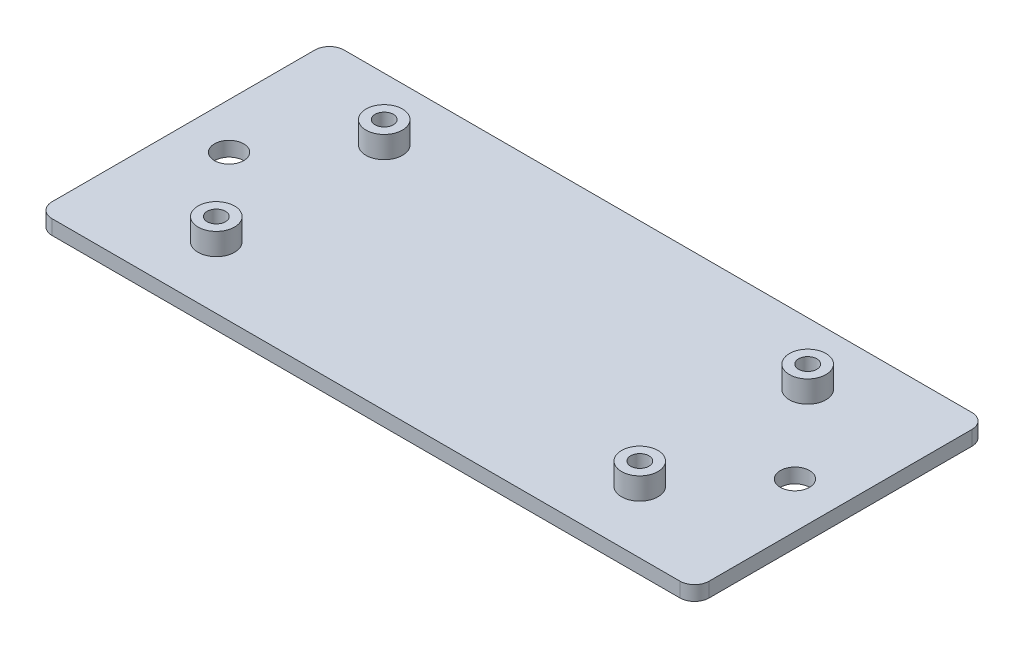
from build123d import *

# Parameters (mm, degrees)
SKETCH_1_W               = 90
SKETCH_1_H               = 40
EXTRUDE_1_DEPTH          = 2
SKETCH_2_R               = 2.5
EXTRUDE_2_DEPTH          = 3
CUT_EXTRUDE_1_DEPTH      = 99.615414617
CUT_EXTRUDE_1_DEPTH_BACK = 99.615414617
SKETCH_3_R               = 1.25
SKETCH_4_R               = 2
CUT_EXTRUDE_2_DEPTH      = 99.534258002
FILLET_1_R               = 2
FILLET_2_R               = 2
FILLET_3_R               = 2
FILLET_4_R               = 2


with BuildPart() as part:
    # Эскиз1 → Бобышка-Вытянуть1 (new body)
    with BuildSketch(Plane(origin=(0, 0, 0), x_dir=(1, 0, 0), z_dir=(0, 1, 0))):
        with Locations((45, -20)):
            Rectangle(SKETCH_1_W, SKETCH_1_H)
    extrude(amount=EXTRUDE_1_DEPTH)

    # Эскиз2 → Бобышка-Вытянуть2 (add)
    with BuildSketch(Plane(origin=(0, 2, 0), x_dir=(1, 0, 0), z_dir=(0, 1, 0))):
        with Locations((16, -8.5)):
            Circle(SKETCH_2_R)
        with Locations((16, -31.5)):
            Circle(SKETCH_2_R)
        with Locations((74, -8.5)):
            Circle(SKETCH_2_R)
        with Locations((74, -31.5)):
            Circle(SKETCH_2_R)
    extrude(amount=EXTRUDE_2_DEPTH)

    # Эскиз3 → Вырез-Вытянуть1 (cut, two sides: drawn at the far end of the back side and taken through both)
    with BuildSketch(Plane(origin=(0, 5, 0), x_dir=(1, 0, 0), z_dir=(0, 1, 0)).offset(-CUT_EXTRUDE_1_DEPTH_BACK)):
        with Locations((16, -8.5)):
            Circle(SKETCH_3_R)
        with Locations((16, -31.5)):
            Circle(SKETCH_3_R)
        with Locations((74, -8.5)):
            Circle(SKETCH_3_R)
        with Locations((74, -31.5)):
            Circle(SKETCH_3_R)
    extrude(amount=CUT_EXTRUDE_1_DEPTH + CUT_EXTRUDE_1_DEPTH_BACK, mode=Mode.SUBTRACT)

    # Эскиз4 → Вырез-Вытянуть2 (cut, through all)
    with BuildSketch(Plane(origin=(0, 2, 0), x_dir=(1, 0, 0), z_dir=(0, 1, 0))):
        with Locations((6.25, -20)):
            Circle(SKETCH_4_R)
        with Locations((83.75, -20)):
            Circle(SKETCH_4_R)
    extrude(amount=-CUT_EXTRUDE_2_DEPTH, mode=Mode.SUBTRACT)

    # Скругление1
    fillet_1_edges = [part.edges().sort_by_distance(p)[0] for p in [
        (0, 1, 0),
    ]]
    fillet(fillet_1_edges, radius=FILLET_1_R)

    # Скругление2
    fillet_2_edges = [part.edges().sort_by_distance(p)[0] for p in [
        (0, 1, 40),
    ]]
    fillet(fillet_2_edges, radius=FILLET_2_R)

    # Скругление3
    fillet_3_edges = [part.edges().sort_by_distance(p)[0] for p in [
        (90, 1, 40),
    ]]
    fillet(fillet_3_edges, radius=FILLET_3_R)

    # Скругление4
    fillet_4_edges = [part.edges().sort_by_distance(p)[0] for p in [
        (90, 1, 0),
    ]]
    fillet(fillet_4_edges, radius=FILLET_4_R)


solid = part.part
